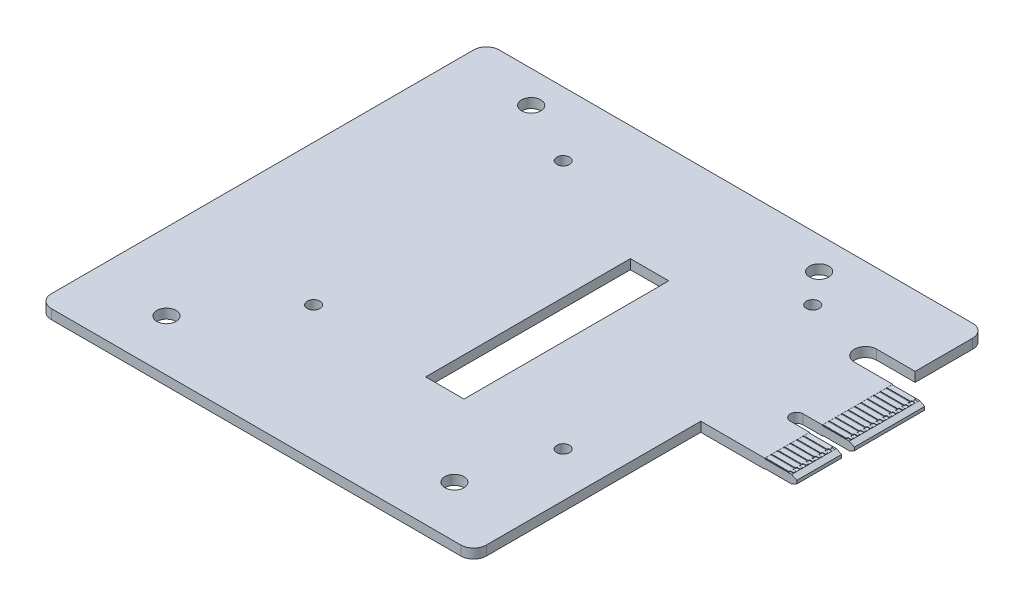
from build123d import *
from OCP.BRepFilletAPI import BRepFilletAPI_MakeChamfer

# Parameters (mm, degrees)
EXTRUDE_1_DEPTH                      = 1.5
CHAMFER_1_SIZE                       = 0.5
CHAMFER_1_SIZE2                      = 1
CHAMFER_2_SIZE                       = 1
CHAMFER_2_SIZE2                      = 0.5
CUT_EXTRUDE_1_DEPTH                  = 57.242777314
FILLET_1_R                           = 2
SKETCH_3_R                           = 1.5
CUT_EXTRUDE_2_DEPTH                  = 57.242777314
PATTERN_LINEAR_1_COUNT               = 2
PATTERN_LINEAR_1_PITCH               = 45
PATTERN_LINEAR_1_COUNT_DIR2          = 2
PATTERN_LINEAR_1_PITCH_DIR2          = 57
SKETCH_5_R                           = 1
CUT_EXTRUDE_3_DEPTH                  = 57.242777314
PATTERN_LINEAR_2_COUNT               = 2
PATTERN_LINEAR_2_PITCH               = 39
PATTERN_LINEAR_2_COUNT_DIR2          = 2
PATTERN_LINEAR_2_PITCH_DIR2          = 39
SKETCH_9_W                           = 6
SKETCH_9_H                           = 32
CUT_EXTRUDE_6_DEPTH                  = 57.242777314
SKETCH_6_W                           = 5
SKETCH_6_H                           = 20
CUT_EXTRUDE_4_DEPTH                  = 0.1
EXTRUDE_3_DEPTH                      = 0.09
CHAMFER_3_SIZE2                      = 0.09
CHAMFER_3_SIZE                       = 0.3
PATTERN_LINEAR_3_COUNT               = 11
PATTERN_LINEAR_3_PITCH               = 1
CHAMFER_3_OF_PATTERN_LINEAR_3_SIZE   = 0.3
CHAMFER_3_OF_PATTERN_LINEAR_3_SIZE_2 = 0.09
EXTRUDE_4_DEPTH                      = 0.09
CHAMFER_4_SIZE2                      = 0.09
CHAMFER_4_SIZE                       = 0.3
PATTERN_LINEAR_4_COUNT               = 7
PATTERN_LINEAR_4_PITCH               = 1
CHAMFER_4_OF_PATTERN_LINEAR_4_SIZE   = 0.3
CHAMFER_4_OF_PATTERN_LINEAR_4_SIZE_2 = 0.09
CHAMFER_5_SIZE2                      = 0.3
CHAMFER_5_SIZE                       = 0.09
PATTERN_LINEAR_5_COUNT               = 11
PATTERN_LINEAR_5_PITCH               = 1
PATTERN_LINEAR_5_COPY_1_DEPTH        = 0.09
PATTERN_LINEAR_5_COPY_2_DEPTH        = 0.09
PATTERN_LINEAR_5_COPY_3_DEPTH        = 0.09
PATTERN_LINEAR_5_COPY_4_DEPTH        = 0.09
PATTERN_LINEAR_5_COPY_5_DEPTH        = 0.09
PATTERN_LINEAR_5_COPY_6_DEPTH        = 0.09
PATTERN_LINEAR_5_COPY_7_DEPTH        = 0.09
PATTERN_LINEAR_5_COPY_8_DEPTH        = 0.09
PATTERN_LINEAR_5_COPY_9_DEPTH        = 0.09
PATTERN_LINEAR_5_COPY_10_DEPTH       = 0.09
CHAMFER_5_OF_PATTERN_LINEAR_5_SIZE   = 0.09
CHAMFER_5_OF_PATTERN_LINEAR_5_SIZE_2 = 0.3
CHAMFER_6_SIZE2                      = 0.09
CHAMFER_6_SIZE                       = 0.3
PATTERN_LINEAR_6_COUNT               = 7
PATTERN_LINEAR_6_PITCH               = 1
PATTERN_LINEAR_6_COPY_1_DEPTH        = 0.09
PATTERN_LINEAR_6_COPY_2_DEPTH        = 0.09
PATTERN_LINEAR_6_COPY_3_DEPTH        = 0.09
PATTERN_LINEAR_6_COPY_4_DEPTH        = 0.09
PATTERN_LINEAR_6_COPY_5_DEPTH        = 0.09
PATTERN_LINEAR_6_COPY_6_DEPTH        = 0.09
CHAMFER_6_OF_PATTERN_LINEAR_6_SIZE   = 0.3
CHAMFER_6_OF_PATTERN_LINEAR_6_SIZE_2 = 0.09


with BuildPart() as part:
    # 草图1 → 凸台-拉伸1 (new body)
    with BuildSketch(Plane(origin=(0, 0, 0), x_dir=(1, 0, 0), z_dir=(0, 1, 0))):
        Polygon((39, 35), (-39, 35), (-39, -35), (29, -35), (29, 0.5), (39, 0.5), (44, 0.5), (44, 20.5), (39, 20.5), align=None)
    extrude(amount=EXTRUDE_1_DEPTH)

    # 倒角1
    chamfer_1_edges = [part.edges().sort_by_distance(p)[0] for p in [
        (44, 1.5, -10.5),
    ]]
    chamfer_1_side = [part.faces().sort_by_distance(p)[0] for p in [
        (44, 0.75, -10.5),
    ]]
    chamfer(chamfer_1_edges, length=CHAMFER_1_SIZE, length2=CHAMFER_1_SIZE2, reference=chamfer_1_side[0])

    # 倒角2
    chamfer_2_edges = [part.edges().sort_by_distance(p)[0] for p in [
        (44, 0, -10.5),
    ]]
    chamfer_2_side = [part.faces().sort_by_distance(p)[0] for p in [
        (-1.521613833, 0, -1.378242075),
    ]]
    chamfer(chamfer_2_edges, length=CHAMFER_2_SIZE, length2=CHAMFER_2_SIZE2, reference=chamfer_2_side[0])

    # 草图2 → 切除-拉伸1 (cut, through all)
    with BuildSketch(Plane(origin=(0, 0, 0), x_dir=(1, 0, 0), z_dir=(0, 1, 0))):
        with BuildLine():
            Line((39, 20.5), (33, 20.5))
            ThreePointArc((33, 20.5), (31.25, 22.25), (33, 24))
            Line((33, 24), (39, 24))
            Line((39, 24), (39, 20.5))
        make_face()
        with BuildLine():
            Line((44, 7.5), (36, 7.5))
            ThreePointArc((36, 7.5), (35, 8.5), (36, 9.5))
            Line((36, 9.5), (44, 9.5))
            Line((44, 9.5), (44, 7.5))
        make_face()
    extrude(amount=CUT_EXTRUDE_1_DEPTH, mode=Mode.SUBTRACT)

    # 圆角1
    fillet_1_edges = [part.edges().sort_by_distance(p)[0] for p in [
        (-39, 0.75, -35),
        (39, 0.75, -35),
        (29, 0.75, 35),
        (-39, 0.75, 35),
    ]]
    fillet(fillet_1_edges, radius=FILLET_1_R)

    # 草图3 → 切除-拉伸2 (cut, through all)
    with BuildSketch(Plane(origin=(0, 0, 0), x_dir=(1, 0, 0), z_dir=(0, 1, 0))):
        with Locations(Location((-27, 30, 0), (0, 0, 270))):
            Circle(SKETCH_3_R)
    cut_extrude_2 = extrude(amount=CUT_EXTRUDE_2_DEPTH, mode=Mode.SUBTRACT)

    # 阵列(线性)1: Cut-Extrude 2 2 × 2
    with Locations(*[(i * PATTERN_LINEAR_1_PITCH, 0, j * PATTERN_LINEAR_1_PITCH_DIR2) for i in range(PATTERN_LINEAR_1_COUNT) for j in range(PATTERN_LINEAR_1_COUNT_DIR2) if (i, j) != (0, 0)]):
        add(cut_extrude_2, mode=Mode.SUBTRACT)

    # 草图5 → 切除-拉伸3 (cut, through all)
    with BuildSketch(Plane(origin=(0, 0, 0), x_dir=(1, 0, 0), z_dir=(0, 1, 0))):
        with Locations(Location((-17, 25, 0), (0, 0, 270))):
            Circle(SKETCH_5_R)
    cut_extrude_3 = extrude(amount=CUT_EXTRUDE_3_DEPTH, mode=Mode.SUBTRACT)

    # 阵列(线性)2: Cut-Extrude 3 2 × 2
    with Locations(*[(i * PATTERN_LINEAR_2_PITCH, 0, j * PATTERN_LINEAR_2_PITCH_DIR2) for i in range(PATTERN_LINEAR_2_COUNT) for j in range(PATTERN_LINEAR_2_COUNT_DIR2) if (i, j) != (0, 0)]):
        add(cut_extrude_3, mode=Mode.SUBTRACT)

    # 草图9 → 切除-拉伸6 (cut, through all)
    with BuildSketch(Plane(origin=(0, 0, 0), x_dir=(1, 0, 0), z_dir=(0, 1, 0))):
        with Locations((4.5, 1)):
            Rectangle(SKETCH_9_W, SKETCH_9_H)
    extrude(amount=CUT_EXTRUDE_6_DEPTH, mode=Mode.SUBTRACT)

    # 草图6 → 切除-拉伸4 (cut)
    with BuildSketch(Plane(origin=(0, 1.5, 0), x_dir=(1, 0, 0), z_dir=(0, 1, 0))):
        with Locations((41.5, 10.5)):
            Rectangle(SKETCH_6_W, SKETCH_6_H)
    cut_extrude_4 = extrude(amount=-CUT_EXTRUDE_4_DEPTH, mode=Mode.SUBTRACT)

    # 草图7 → 凸台-拉伸3 (add)
    with BuildSketch(Plane(origin=(0, 1.4, 0), x_dir=(1, 0, 0), z_dir=(0, 1, 0))):
        Polygon((39, 20.4), (42.7, 20.4), (42.7, 20.2), (43.2, 20.2), (43.2, 19.8), (42.7, 19.8), (42.7, 19.6), (39, 19.6), align=None)
    extrude_3 = extrude(amount=EXTRUDE_3_DEPTH)

    # 倒角3
    chamfer_3_edges = [part.edges().sort_by_distance(p)[0] for p in [
        (43.2, 1.49, -20),
    ]]
    chamfer_3_side = [part.faces().sort_by_distance(p)[0] for p in [
        (43.1982, 1.49, -20),
    ]]
    chamfer(chamfer_3_edges, length=CHAMFER_3_SIZE - 0.0001, length2=CHAMFER_3_SIZE2 - 0.0001, reference=chamfer_3_side[0])  # a hair under: the kernel refuses the full size

    # 阵列(线性)3: 凸台-拉伸3 ×11
    with Locations(*[(0, 0, i * PATTERN_LINEAR_3_PITCH) for i in range(1, PATTERN_LINEAR_3_COUNT)]):
        add(extrude_3)

    # 倒角3 of 阵列(线性)3
    chamfer_3_of_pattern_linear_3_edges_1 = [part.edges().sort_by_distance(p)[0] for p in [
        (43.2, 1.49, -19),
    ]]
    chamfer_3_of_pattern_linear_3_side_1 = [part.faces().sort_by_distance(p)[0] for p in [
        (43.1982, 1.49, -19),
    ]]
    chamfer_3_of_pattern_linear_3_edges_2 = [part.edges().sort_by_distance(p)[0] for p in [
        (43.2, 1.49, -18),
    ]]
    chamfer_3_of_pattern_linear_3_side_2 = [part.faces().sort_by_distance(p)[0] for p in [
        (43.1982, 1.49, -18),
    ]]
    chamfer_3_of_pattern_linear_3_edges_3 = [part.edges().sort_by_distance(p)[0] for p in [
        (43.2, 1.49, -17),
    ]]
    chamfer_3_of_pattern_linear_3_side_3 = [part.faces().sort_by_distance(p)[0] for p in [
        (43.1982, 1.49, -17),
    ]]
    chamfer_3_of_pattern_linear_3_edges_4 = [part.edges().sort_by_distance(p)[0] for p in [
        (43.2, 1.49, -16),
    ]]
    chamfer_3_of_pattern_linear_3_side_4 = [part.faces().sort_by_distance(p)[0] for p in [
        (43.1982, 1.49, -16),
    ]]
    chamfer_3_of_pattern_linear_3_edges_5 = [part.edges().sort_by_distance(p)[0] for p in [
        (43.2, 1.49, -15),
    ]]
    chamfer_3_of_pattern_linear_3_side_5 = [part.faces().sort_by_distance(p)[0] for p in [
        (43.1982, 1.49, -15),
    ]]
    chamfer_3_of_pattern_linear_3_edges_6 = [part.edges().sort_by_distance(p)[0] for p in [
        (43.2, 1.49, -14),
    ]]
    chamfer_3_of_pattern_linear_3_side_6 = [part.faces().sort_by_distance(p)[0] for p in [
        (43.1982, 1.49, -14),
    ]]
    chamfer_3_of_pattern_linear_3_edges_7 = [part.edges().sort_by_distance(p)[0] for p in [
        (43.2, 1.49, -13),
    ]]
    chamfer_3_of_pattern_linear_3_side_7 = [part.faces().sort_by_distance(p)[0] for p in [
        (43.1982, 1.49, -13),
    ]]
    chamfer_3_of_pattern_linear_3_edges_8 = [part.edges().sort_by_distance(p)[0] for p in [
        (43.2, 1.49, -12),
    ]]
    chamfer_3_of_pattern_linear_3_side_8 = [part.faces().sort_by_distance(p)[0] for p in [
        (43.1982, 1.49, -12),
    ]]
    chamfer_3_of_pattern_linear_3_edges_9 = [part.edges().sort_by_distance(p)[0] for p in [
        (43.2, 1.49, -11),
    ]]
    chamfer_3_of_pattern_linear_3_side_9 = [part.faces().sort_by_distance(p)[0] for p in [
        (43.1982, 1.49, -11),
    ]]
    chamfer_3_of_pattern_linear_3_edges_10 = [part.edges().sort_by_distance(p)[0] for p in [
        (43.2, 1.49, -10),
    ]]
    chamfer_3_of_pattern_linear_3_side_10 = [part.faces().sort_by_distance(p)[0] for p in [
        (43.1982, 1.49, -10),
    ]]
    chamfer_3_of_pattern_linear_3 = BRepFilletAPI_MakeChamfer(part.part.solid().wrapped)
    for e in chamfer_3_of_pattern_linear_3_edges_1:
        chamfer_3_of_pattern_linear_3.Add(CHAMFER_3_OF_PATTERN_LINEAR_3_SIZE - 0.0001, CHAMFER_3_OF_PATTERN_LINEAR_3_SIZE_2 - 0.0001, e.wrapped, chamfer_3_of_pattern_linear_3_side_1[0].wrapped)
    for e in chamfer_3_of_pattern_linear_3_edges_2:
        chamfer_3_of_pattern_linear_3.Add(CHAMFER_3_OF_PATTERN_LINEAR_3_SIZE - 0.0001, CHAMFER_3_OF_PATTERN_LINEAR_3_SIZE_2 - 0.0001, e.wrapped, chamfer_3_of_pattern_linear_3_side_2[0].wrapped)
    for e in chamfer_3_of_pattern_linear_3_edges_3:
        chamfer_3_of_pattern_linear_3.Add(CHAMFER_3_OF_PATTERN_LINEAR_3_SIZE - 0.0001, CHAMFER_3_OF_PATTERN_LINEAR_3_SIZE_2 - 0.0001, e.wrapped, chamfer_3_of_pattern_linear_3_side_3[0].wrapped)
    for e in chamfer_3_of_pattern_linear_3_edges_4:
        chamfer_3_of_pattern_linear_3.Add(CHAMFER_3_OF_PATTERN_LINEAR_3_SIZE - 0.0001, CHAMFER_3_OF_PATTERN_LINEAR_3_SIZE_2 - 0.0001, e.wrapped, chamfer_3_of_pattern_linear_3_side_4[0].wrapped)
    for e in chamfer_3_of_pattern_linear_3_edges_5:
        chamfer_3_of_pattern_linear_3.Add(CHAMFER_3_OF_PATTERN_LINEAR_3_SIZE - 0.0001, CHAMFER_3_OF_PATTERN_LINEAR_3_SIZE_2 - 0.0001, e.wrapped, chamfer_3_of_pattern_linear_3_side_5[0].wrapped)
    for e in chamfer_3_of_pattern_linear_3_edges_6:
        chamfer_3_of_pattern_linear_3.Add(CHAMFER_3_OF_PATTERN_LINEAR_3_SIZE - 0.0001, CHAMFER_3_OF_PATTERN_LINEAR_3_SIZE_2 - 0.0001, e.wrapped, chamfer_3_of_pattern_linear_3_side_6[0].wrapped)
    for e in chamfer_3_of_pattern_linear_3_edges_7:
        chamfer_3_of_pattern_linear_3.Add(CHAMFER_3_OF_PATTERN_LINEAR_3_SIZE - 0.0001, CHAMFER_3_OF_PATTERN_LINEAR_3_SIZE_2 - 0.0001, e.wrapped, chamfer_3_of_pattern_linear_3_side_7[0].wrapped)
    for e in chamfer_3_of_pattern_linear_3_edges_8:
        chamfer_3_of_pattern_linear_3.Add(CHAMFER_3_OF_PATTERN_LINEAR_3_SIZE - 0.0001, CHAMFER_3_OF_PATTERN_LINEAR_3_SIZE_2 - 0.0001, e.wrapped, chamfer_3_of_pattern_linear_3_side_8[0].wrapped)
    for e in chamfer_3_of_pattern_linear_3_edges_9:
        chamfer_3_of_pattern_linear_3.Add(CHAMFER_3_OF_PATTERN_LINEAR_3_SIZE - 0.0001, CHAMFER_3_OF_PATTERN_LINEAR_3_SIZE_2 - 0.0001, e.wrapped, chamfer_3_of_pattern_linear_3_side_9[0].wrapped)
    for e in chamfer_3_of_pattern_linear_3_edges_10:
        chamfer_3_of_pattern_linear_3.Add(CHAMFER_3_OF_PATTERN_LINEAR_3_SIZE - 0.0001, CHAMFER_3_OF_PATTERN_LINEAR_3_SIZE_2 - 0.0001, e.wrapped, chamfer_3_of_pattern_linear_3_side_10[0].wrapped)
    add(Compound.cast(chamfer_3_of_pattern_linear_3.Shape()), mode=Mode.REPLACE)  # a hair under: the kernel refuses the full size

    # 草图8 → 凸台-拉伸4 (add)
    with BuildSketch(Plane(origin=(0, 1.4, 0), x_dir=(1, 0, 0), z_dir=(0, 1, 0))):
        Polygon((39, 7.4), (42.7, 7.4), (42.7, 7.2), (43.2, 7.2), (43.2, 6.8), (42.7, 6.8), (42.7, 6.6), (39, 6.6), align=None)
    extrude_4 = extrude(amount=EXTRUDE_4_DEPTH)

    # 倒角4
    chamfer_4_edges = [part.edges().sort_by_distance(p)[0] for p in [
        (43.2, 1.49, -7),
    ]]
    chamfer_4_side = [part.faces().sort_by_distance(p)[0] for p in [
        (43.1982, 1.49, -7),
    ]]
    chamfer(chamfer_4_edges, length=CHAMFER_4_SIZE - 0.0001, length2=CHAMFER_4_SIZE2 - 0.0001, reference=chamfer_4_side[0])  # a hair under: the kernel refuses the full size

    # 阵列(线性)4: 凸台-拉伸4 ×7
    with Locations(*[(0, 0, i * PATTERN_LINEAR_4_PITCH) for i in range(1, PATTERN_LINEAR_4_COUNT)]):
        add(extrude_4)

    # 倒角4 of 阵列(线性)4
    chamfer_4_of_pattern_linear_4_edges_1 = [part.edges().sort_by_distance(p)[0] for p in [
        (43.2, 1.49, -6),
    ]]
    chamfer_4_of_pattern_linear_4_side_1 = [part.faces().sort_by_distance(p)[0] for p in [
        (43.1982, 1.49, -6),
    ]]
    chamfer_4_of_pattern_linear_4_edges_2 = [part.edges().sort_by_distance(p)[0] for p in [
        (43.2, 1.49, -5),
    ]]
    chamfer_4_of_pattern_linear_4_side_2 = [part.faces().sort_by_distance(p)[0] for p in [
        (43.1982, 1.49, -5),
    ]]
    chamfer_4_of_pattern_linear_4_edges_3 = [part.edges().sort_by_distance(p)[0] for p in [
        (43.2, 1.49, -4),
    ]]
    chamfer_4_of_pattern_linear_4_side_3 = [part.faces().sort_by_distance(p)[0] for p in [
        (43.1982, 1.49, -4),
    ]]
    chamfer_4_of_pattern_linear_4_edges_4 = [part.edges().sort_by_distance(p)[0] for p in [
        (43.2, 1.49, -3),
    ]]
    chamfer_4_of_pattern_linear_4_side_4 = [part.faces().sort_by_distance(p)[0] for p in [
        (43.1982, 1.49, -3),
    ]]
    chamfer_4_of_pattern_linear_4_edges_5 = [part.edges().sort_by_distance(p)[0] for p in [
        (43.2, 1.49, -2),
    ]]
    chamfer_4_of_pattern_linear_4_side_5 = [part.faces().sort_by_distance(p)[0] for p in [
        (43.1982, 1.49, -2),
    ]]
    chamfer_4_of_pattern_linear_4_edges_6 = [part.edges().sort_by_distance(p)[0] for p in [
        (43.2, 1.49, -1),
    ]]
    chamfer_4_of_pattern_linear_4_side_6 = [part.faces().sort_by_distance(p)[0] for p in [
        (43.1982, 1.49, -1),
    ]]
    chamfer_4_of_pattern_linear_4 = BRepFilletAPI_MakeChamfer(part.part.solid().wrapped)
    for e in chamfer_4_of_pattern_linear_4_edges_1:
        chamfer_4_of_pattern_linear_4.Add(CHAMFER_4_OF_PATTERN_LINEAR_4_SIZE - 0.0001, CHAMFER_4_OF_PATTERN_LINEAR_4_SIZE_2 - 0.0001, e.wrapped, chamfer_4_of_pattern_linear_4_side_1[0].wrapped)
    for e in chamfer_4_of_pattern_linear_4_edges_2:
        chamfer_4_of_pattern_linear_4.Add(CHAMFER_4_OF_PATTERN_LINEAR_4_SIZE - 0.0001, CHAMFER_4_OF_PATTERN_LINEAR_4_SIZE_2 - 0.0001, e.wrapped, chamfer_4_of_pattern_linear_4_side_2[0].wrapped)
    for e in chamfer_4_of_pattern_linear_4_edges_3:
        chamfer_4_of_pattern_linear_4.Add(CHAMFER_4_OF_PATTERN_LINEAR_4_SIZE - 0.0001, CHAMFER_4_OF_PATTERN_LINEAR_4_SIZE_2 - 0.0001, e.wrapped, chamfer_4_of_pattern_linear_4_side_3[0].wrapped)
    for e in chamfer_4_of_pattern_linear_4_edges_4:
        chamfer_4_of_pattern_linear_4.Add(CHAMFER_4_OF_PATTERN_LINEAR_4_SIZE - 0.0001, CHAMFER_4_OF_PATTERN_LINEAR_4_SIZE_2 - 0.0001, e.wrapped, chamfer_4_of_pattern_linear_4_side_4[0].wrapped)
    for e in chamfer_4_of_pattern_linear_4_edges_5:
        chamfer_4_of_pattern_linear_4.Add(CHAMFER_4_OF_PATTERN_LINEAR_4_SIZE - 0.0001, CHAMFER_4_OF_PATTERN_LINEAR_4_SIZE_2 - 0.0001, e.wrapped, chamfer_4_of_pattern_linear_4_side_5[0].wrapped)
    for e in chamfer_4_of_pattern_linear_4_edges_6:
        chamfer_4_of_pattern_linear_4.Add(CHAMFER_4_OF_PATTERN_LINEAR_4_SIZE - 0.0001, CHAMFER_4_OF_PATTERN_LINEAR_4_SIZE_2 - 0.0001, e.wrapped, chamfer_4_of_pattern_linear_4_side_6[0].wrapped)
    add(Compound.cast(chamfer_4_of_pattern_linear_4.Shape()), mode=Mode.REPLACE)  # a hair under: the kernel refuses the full size

    # 镜向2: 切除-拉伸4 across plane
    add(cut_extrude_4.mirror(Plane.ZX.offset(0.75)), mode=Mode.SUBTRACT)

    # 镜向5: 凸台-拉伸3 across plane
    add(extrude_3.mirror(Plane.ZX.offset(0.75)))

    # 倒角5
    chamfer_5_edges = [part.edges().sort_by_distance(p)[0] for p in [
        (43.2, 0.01, -20),
    ]]
    chamfer_5_side = [part.faces().sort_by_distance(p)[0] for p in [
        (43.2, 0.0118, -20),
    ]]
    chamfer(chamfer_5_edges, length=CHAMFER_5_SIZE - 0.0001, length2=CHAMFER_5_SIZE2 - 0.0001, reference=chamfer_5_side[0])  # a hair under: the kernel refuses the full size

    # 阵列(线性)5: 凸台-拉伸3 ×11
    with Locations(*[(0, 0, i * PATTERN_LINEAR_5_PITCH) for i in range(1, PATTERN_LINEAR_5_COUNT)]):
        add(extrude_3)

    # 阵列(线性)5 copy 1 sketch → 阵列(线性)5 copy 1 (add)
    with BuildSketch(Plane(origin=(0, 0.1, 1), x_dir=(1, 0, 0), z_dir=(0, -1, 0))):
        Polygon((39, -20.4), (42.7, -20.4), (42.7, -20.2), (43.2, -20.2), (43.2, -19.8), (42.7, -19.8), (42.7, -19.6), (39, -19.6), align=None)
    extrude(amount=PATTERN_LINEAR_5_COPY_1_DEPTH)

    # 阵列(线性)5 copy 2 sketch → 阵列(线性)5 copy 2 (add)
    with BuildSketch(Plane(origin=(0, 0.1, 2), x_dir=(1, 0, 0), z_dir=(0, -1, 0))):
        Polygon((39, -20.4), (42.7, -20.4), (42.7, -20.2), (43.2, -20.2), (43.2, -19.8), (42.7, -19.8), (42.7, -19.6), (39, -19.6), align=None)
    extrude(amount=PATTERN_LINEAR_5_COPY_2_DEPTH)

    # 阵列(线性)5 copy 3 sketch → 阵列(线性)5 copy 3 (add)
    with BuildSketch(Plane(origin=(0, 0.1, 3), x_dir=(1, 0, 0), z_dir=(0, -1, 0))):
        Polygon((39, -20.4), (42.7, -20.4), (42.7, -20.2), (43.2, -20.2), (43.2, -19.8), (42.7, -19.8), (42.7, -19.6), (39, -19.6), align=None)
    extrude(amount=PATTERN_LINEAR_5_COPY_3_DEPTH)

    # 阵列(线性)5 copy 4 sketch → 阵列(线性)5 copy 4 (add)
    with BuildSketch(Plane(origin=(0, 0.1, 4), x_dir=(1, 0, 0), z_dir=(0, -1, 0))):
        Polygon((39, -20.4), (42.7, -20.4), (42.7, -20.2), (43.2, -20.2), (43.2, -19.8), (42.7, -19.8), (42.7, -19.6), (39, -19.6), align=None)
    extrude(amount=PATTERN_LINEAR_5_COPY_4_DEPTH)

    # 阵列(线性)5 copy 5 sketch → 阵列(线性)5 copy 5 (add)
    with BuildSketch(Plane(origin=(0, 0.1, 5), x_dir=(1, 0, 0), z_dir=(0, -1, 0))):
        Polygon((39, -20.4), (42.7, -20.4), (42.7, -20.2), (43.2, -20.2), (43.2, -19.8), (42.7, -19.8), (42.7, -19.6), (39, -19.6), align=None)
    extrude(amount=PATTERN_LINEAR_5_COPY_5_DEPTH)

    # 阵列(线性)5 copy 6 sketch → 阵列(线性)5 copy 6 (add)
    with BuildSketch(Plane(origin=(0, 0.1, 6), x_dir=(1, 0, 0), z_dir=(0, -1, 0))):
        Polygon((39, -20.4), (42.7, -20.4), (42.7, -20.2), (43.2, -20.2), (43.2, -19.8), (42.7, -19.8), (42.7, -19.6), (39, -19.6), align=None)
    extrude(amount=PATTERN_LINEAR_5_COPY_6_DEPTH)

    # 阵列(线性)5 copy 7 sketch → 阵列(线性)5 copy 7 (add)
    with BuildSketch(Plane(origin=(0, 0.1, 7), x_dir=(1, 0, 0), z_dir=(0, -1, 0))):
        Polygon((39, -20.4), (42.7, -20.4), (42.7, -20.2), (43.2, -20.2), (43.2, -19.8), (42.7, -19.8), (42.7, -19.6), (39, -19.6), align=None)
    extrude(amount=PATTERN_LINEAR_5_COPY_7_DEPTH)

    # 阵列(线性)5 copy 8 sketch → 阵列(线性)5 copy 8 (add)
    with BuildSketch(Plane(origin=(0, 0.1, 8), x_dir=(1, 0, 0), z_dir=(0, -1, 0))):
        Polygon((39, -20.4), (42.7, -20.4), (42.7, -20.2), (43.2, -20.2), (43.2, -19.8), (42.7, -19.8), (42.7, -19.6), (39, -19.6), align=None)
    extrude(amount=PATTERN_LINEAR_5_COPY_8_DEPTH)

    # 阵列(线性)5 copy 9 sketch → 阵列(线性)5 copy 9 (add)
    with BuildSketch(Plane(origin=(0, 0.1, 9), x_dir=(1, 0, 0), z_dir=(0, -1, 0))):
        Polygon((39, -20.4), (42.7, -20.4), (42.7, -20.2), (43.2, -20.2), (43.2, -19.8), (42.7, -19.8), (42.7, -19.6), (39, -19.6), align=None)
    extrude(amount=PATTERN_LINEAR_5_COPY_9_DEPTH)

    # 阵列(线性)5 copy 10 sketch → 阵列(线性)5 copy 10 (add)
    with BuildSketch(Plane(origin=(0, 0.1, 10), x_dir=(1, 0, 0), z_dir=(0, -1, 0))):
        Polygon((39, -20.4), (42.7, -20.4), (42.7, -20.2), (43.2, -20.2), (43.2, -19.8), (42.7, -19.8), (42.7, -19.6), (39, -19.6), align=None)
    extrude(amount=PATTERN_LINEAR_5_COPY_10_DEPTH)

    # 倒角5 of 阵列(线性)5
    chamfer_5_of_pattern_linear_5_edges_1 = [part.edges().sort_by_distance(p)[0] for p in [
        (43.2, 0.01, -19),
    ]]
    chamfer_5_of_pattern_linear_5_side_1 = [part.faces().sort_by_distance(p)[0] for p in [
        (43.2, 0.0118, -19),
    ]]
    chamfer_5_of_pattern_linear_5_edges_2 = [part.edges().sort_by_distance(p)[0] for p in [
        (43.2, 0.01, -18),
    ]]
    chamfer_5_of_pattern_linear_5_side_2 = [part.faces().sort_by_distance(p)[0] for p in [
        (43.2, 0.0118, -18),
    ]]
    chamfer_5_of_pattern_linear_5_edges_3 = [part.edges().sort_by_distance(p)[0] for p in [
        (43.2, 0.01, -17),
    ]]
    chamfer_5_of_pattern_linear_5_side_3 = [part.faces().sort_by_distance(p)[0] for p in [
        (43.2, 0.0118, -17),
    ]]
    chamfer_5_of_pattern_linear_5_edges_4 = [part.edges().sort_by_distance(p)[0] for p in [
        (43.2, 0.01, -16),
    ]]
    chamfer_5_of_pattern_linear_5_side_4 = [part.faces().sort_by_distance(p)[0] for p in [
        (43.2, 0.0118, -16),
    ]]
    chamfer_5_of_pattern_linear_5_edges_5 = [part.edges().sort_by_distance(p)[0] for p in [
        (43.2, 0.01, -15),
    ]]
    chamfer_5_of_pattern_linear_5_side_5 = [part.faces().sort_by_distance(p)[0] for p in [
        (43.2, 0.0118, -15),
    ]]
    chamfer_5_of_pattern_linear_5_edges_6 = [part.edges().sort_by_distance(p)[0] for p in [
        (43.2, 0.01, -14),
    ]]
    chamfer_5_of_pattern_linear_5_side_6 = [part.faces().sort_by_distance(p)[0] for p in [
        (43.2, 0.0118, -14),
    ]]
    chamfer_5_of_pattern_linear_5_edges_7 = [part.edges().sort_by_distance(p)[0] for p in [
        (43.2, 0.01, -13),
    ]]
    chamfer_5_of_pattern_linear_5_side_7 = [part.faces().sort_by_distance(p)[0] for p in [
        (43.2, 0.0118, -13),
    ]]
    chamfer_5_of_pattern_linear_5_edges_8 = [part.edges().sort_by_distance(p)[0] for p in [
        (43.2, 0.01, -12),
    ]]
    chamfer_5_of_pattern_linear_5_side_8 = [part.faces().sort_by_distance(p)[0] for p in [
        (43.2, 0.0118, -12),
    ]]
    chamfer_5_of_pattern_linear_5_edges_9 = [part.edges().sort_by_distance(p)[0] for p in [
        (43.2, 0.01, -11),
    ]]
    chamfer_5_of_pattern_linear_5_side_9 = [part.faces().sort_by_distance(p)[0] for p in [
        (43.2, 0.0118, -11),
    ]]
    chamfer_5_of_pattern_linear_5_edges_10 = [part.edges().sort_by_distance(p)[0] for p in [
        (43.2, 0.01, -10),
    ]]
    chamfer_5_of_pattern_linear_5_side_10 = [part.faces().sort_by_distance(p)[0] for p in [
        (43.2, 0.0118, -10),
    ]]
    chamfer_5_of_pattern_linear_5 = BRepFilletAPI_MakeChamfer(part.part.solid().wrapped)
    for e in chamfer_5_of_pattern_linear_5_edges_1:
        chamfer_5_of_pattern_linear_5.Add(CHAMFER_5_OF_PATTERN_LINEAR_5_SIZE - 0.0001, CHAMFER_5_OF_PATTERN_LINEAR_5_SIZE_2 - 0.0001, e.wrapped, chamfer_5_of_pattern_linear_5_side_1[0].wrapped)
    for e in chamfer_5_of_pattern_linear_5_edges_2:
        chamfer_5_of_pattern_linear_5.Add(CHAMFER_5_OF_PATTERN_LINEAR_5_SIZE - 0.0001, CHAMFER_5_OF_PATTERN_LINEAR_5_SIZE_2 - 0.0001, e.wrapped, chamfer_5_of_pattern_linear_5_side_2[0].wrapped)
    for e in chamfer_5_of_pattern_linear_5_edges_3:
        chamfer_5_of_pattern_linear_5.Add(CHAMFER_5_OF_PATTERN_LINEAR_5_SIZE - 0.0001, CHAMFER_5_OF_PATTERN_LINEAR_5_SIZE_2 - 0.0001, e.wrapped, chamfer_5_of_pattern_linear_5_side_3[0].wrapped)
    for e in chamfer_5_of_pattern_linear_5_edges_4:
        chamfer_5_of_pattern_linear_5.Add(CHAMFER_5_OF_PATTERN_LINEAR_5_SIZE - 0.0001, CHAMFER_5_OF_PATTERN_LINEAR_5_SIZE_2 - 0.0001, e.wrapped, chamfer_5_of_pattern_linear_5_side_4[0].wrapped)
    for e in chamfer_5_of_pattern_linear_5_edges_5:
        chamfer_5_of_pattern_linear_5.Add(CHAMFER_5_OF_PATTERN_LINEAR_5_SIZE - 0.0001, CHAMFER_5_OF_PATTERN_LINEAR_5_SIZE_2 - 0.0001, e.wrapped, chamfer_5_of_pattern_linear_5_side_5[0].wrapped)
    for e in chamfer_5_of_pattern_linear_5_edges_6:
        chamfer_5_of_pattern_linear_5.Add(CHAMFER_5_OF_PATTERN_LINEAR_5_SIZE - 0.0001, CHAMFER_5_OF_PATTERN_LINEAR_5_SIZE_2 - 0.0001, e.wrapped, chamfer_5_of_pattern_linear_5_side_6[0].wrapped)
    for e in chamfer_5_of_pattern_linear_5_edges_7:
        chamfer_5_of_pattern_linear_5.Add(CHAMFER_5_OF_PATTERN_LINEAR_5_SIZE - 0.0001, CHAMFER_5_OF_PATTERN_LINEAR_5_SIZE_2 - 0.0001, e.wrapped, chamfer_5_of_pattern_linear_5_side_7[0].wrapped)
    for e in chamfer_5_of_pattern_linear_5_edges_8:
        chamfer_5_of_pattern_linear_5.Add(CHAMFER_5_OF_PATTERN_LINEAR_5_SIZE - 0.0001, CHAMFER_5_OF_PATTERN_LINEAR_5_SIZE_2 - 0.0001, e.wrapped, chamfer_5_of_pattern_linear_5_side_8[0].wrapped)
    for e in chamfer_5_of_pattern_linear_5_edges_9:
        chamfer_5_of_pattern_linear_5.Add(CHAMFER_5_OF_PATTERN_LINEAR_5_SIZE - 0.0001, CHAMFER_5_OF_PATTERN_LINEAR_5_SIZE_2 - 0.0001, e.wrapped, chamfer_5_of_pattern_linear_5_side_9[0].wrapped)
    for e in chamfer_5_of_pattern_linear_5_edges_10:
        chamfer_5_of_pattern_linear_5.Add(CHAMFER_5_OF_PATTERN_LINEAR_5_SIZE - 0.0001, CHAMFER_5_OF_PATTERN_LINEAR_5_SIZE_2 - 0.0001, e.wrapped, chamfer_5_of_pattern_linear_5_side_10[0].wrapped)
    add(Compound.cast(chamfer_5_of_pattern_linear_5.Shape()), mode=Mode.REPLACE)  # a hair under: the kernel refuses the full size

    # 镜向7: 凸台-拉伸4 across plane
    add(extrude_4.mirror(Plane.ZX.offset(0.75)))

    # 倒角6
    chamfer_6_edges = [part.edges().sort_by_distance(p)[0] for p in [
        (43.2, 0.01, -7),
    ]]
    chamfer_6_side = [part.faces().sort_by_distance(p)[0] for p in [
        (43.1982, 0.01, -7),
    ]]
    chamfer(chamfer_6_edges, length=CHAMFER_6_SIZE - 0.0001, length2=CHAMFER_6_SIZE2 - 0.0001, reference=chamfer_6_side[0])  # a hair under: the kernel refuses the full size

    # 阵列(线性)6: 凸台-拉伸4 ×7
    with Locations(*[(0, 0, i * PATTERN_LINEAR_6_PITCH) for i in range(1, PATTERN_LINEAR_6_COUNT)]):
        add(extrude_4)

    # 阵列(线性)6 copy 1 sketch → 阵列(线性)6 copy 1 (add)
    with BuildSketch(Plane(origin=(0, 0.1, 1), x_dir=(1, 0, 0), z_dir=(0, -1, 0))):
        Polygon((39, -7.4), (42.7, -7.4), (42.7, -7.2), (43.2, -7.2), (43.2, -6.8), (42.7, -6.8), (42.7, -6.6), (39, -6.6), align=None)
    extrude(amount=PATTERN_LINEAR_6_COPY_1_DEPTH)

    # 阵列(线性)6 copy 2 sketch → 阵列(线性)6 copy 2 (add)
    with BuildSketch(Plane(origin=(0, 0.1, 2), x_dir=(1, 0, 0), z_dir=(0, -1, 0))):
        Polygon((39, -7.4), (42.7, -7.4), (42.7, -7.2), (43.2, -7.2), (43.2, -6.8), (42.7, -6.8), (42.7, -6.6), (39, -6.6), align=None)
    extrude(amount=PATTERN_LINEAR_6_COPY_2_DEPTH)

    # 阵列(线性)6 copy 3 sketch → 阵列(线性)6 copy 3 (add)
    with BuildSketch(Plane(origin=(0, 0.1, 3), x_dir=(1, 0, 0), z_dir=(0, -1, 0))):
        Polygon((39, -7.4), (42.7, -7.4), (42.7, -7.2), (43.2, -7.2), (43.2, -6.8), (42.7, -6.8), (42.7, -6.6), (39, -6.6), align=None)
    extrude(amount=PATTERN_LINEAR_6_COPY_3_DEPTH)

    # 阵列(线性)6 copy 4 sketch → 阵列(线性)6 copy 4 (add)
    with BuildSketch(Plane(origin=(0, 0.1, 4), x_dir=(1, 0, 0), z_dir=(0, -1, 0))):
        Polygon((39, -7.4), (42.7, -7.4), (42.7, -7.2), (43.2, -7.2), (43.2, -6.8), (42.7, -6.8), (42.7, -6.6), (39, -6.6), align=None)
    extrude(amount=PATTERN_LINEAR_6_COPY_4_DEPTH)

    # 阵列(线性)6 copy 5 sketch → 阵列(线性)6 copy 5 (add)
    with BuildSketch(Plane(origin=(0, 0.1, 5), x_dir=(1, 0, 0), z_dir=(0, -1, 0))):
        Polygon((39, -7.4), (42.7, -7.4), (42.7, -7.2), (43.2, -7.2), (43.2, -6.8), (42.7, -6.8), (42.7, -6.6), (39, -6.6), align=None)
    extrude(amount=PATTERN_LINEAR_6_COPY_5_DEPTH)

    # 阵列(线性)6 copy 6 sketch → 阵列(线性)6 copy 6 (add)
    with BuildSketch(Plane(origin=(0, 0.1, 6), x_dir=(1, 0, 0), z_dir=(0, -1, 0))):
        Polygon((39, -7.4), (42.7, -7.4), (42.7, -7.2), (43.2, -7.2), (43.2, -6.8), (42.7, -6.8), (42.7, -6.6), (39, -6.6), align=None)
    extrude(amount=PATTERN_LINEAR_6_COPY_6_DEPTH)

    # 倒角6 of 阵列(线性)6
    chamfer_6_of_pattern_linear_6_edges_1 = [part.edges().sort_by_distance(p)[0] for p in [
        (43.2, 0.01, -6),
    ]]
    chamfer_6_of_pattern_linear_6_side_1 = [part.faces().sort_by_distance(p)[0] for p in [
        (43.1982, 0.01, -6),
    ]]
    chamfer_6_of_pattern_linear_6_edges_2 = [part.edges().sort_by_distance(p)[0] for p in [
        (43.2, 0.01, -5),
    ]]
    chamfer_6_of_pattern_linear_6_side_2 = [part.faces().sort_by_distance(p)[0] for p in [
        (43.1982, 0.01, -5),
    ]]
    chamfer_6_of_pattern_linear_6_edges_3 = [part.edges().sort_by_distance(p)[0] for p in [
        (43.2, 0.01, -4),
    ]]
    chamfer_6_of_pattern_linear_6_side_3 = [part.faces().sort_by_distance(p)[0] for p in [
        (43.1982, 0.01, -4),
    ]]
    chamfer_6_of_pattern_linear_6_edges_4 = [part.edges().sort_by_distance(p)[0] for p in [
        (43.2, 0.01, -3),
    ]]
    chamfer_6_of_pattern_linear_6_side_4 = [part.faces().sort_by_distance(p)[0] for p in [
        (43.1982, 0.01, -3),
    ]]
    chamfer_6_of_pattern_linear_6_edges_5 = [part.edges().sort_by_distance(p)[0] for p in [
        (43.2, 0.01, -2),
    ]]
    chamfer_6_of_pattern_linear_6_side_5 = [part.faces().sort_by_distance(p)[0] for p in [
        (43.1982, 0.01, -2),
    ]]
    chamfer_6_of_pattern_linear_6_edges_6 = [part.edges().sort_by_distance(p)[0] for p in [
        (43.2, 0.01, -1),
    ]]
    chamfer_6_of_pattern_linear_6_side_6 = [part.faces().sort_by_distance(p)[0] for p in [
        (43.1982, 0.01, -1),
    ]]
    chamfer_6_of_pattern_linear_6 = BRepFilletAPI_MakeChamfer(part.part.solid().wrapped)
    for e in chamfer_6_of_pattern_linear_6_edges_1:
        chamfer_6_of_pattern_linear_6.Add(CHAMFER_6_OF_PATTERN_LINEAR_6_SIZE - 0.0001, CHAMFER_6_OF_PATTERN_LINEAR_6_SIZE_2 - 0.0001, e.wrapped, chamfer_6_of_pattern_linear_6_side_1[0].wrapped)
    for e in chamfer_6_of_pattern_linear_6_edges_2:
        chamfer_6_of_pattern_linear_6.Add(CHAMFER_6_OF_PATTERN_LINEAR_6_SIZE - 0.0001, CHAMFER_6_OF_PATTERN_LINEAR_6_SIZE_2 - 0.0001, e.wrapped, chamfer_6_of_pattern_linear_6_side_2[0].wrapped)
    for e in chamfer_6_of_pattern_linear_6_edges_3:
        chamfer_6_of_pattern_linear_6.Add(CHAMFER_6_OF_PATTERN_LINEAR_6_SIZE - 0.0001, CHAMFER_6_OF_PATTERN_LINEAR_6_SIZE_2 - 0.0001, e.wrapped, chamfer_6_of_pattern_linear_6_side_3[0].wrapped)
    for e in chamfer_6_of_pattern_linear_6_edges_4:
        chamfer_6_of_pattern_linear_6.Add(CHAMFER_6_OF_PATTERN_LINEAR_6_SIZE - 0.0001, CHAMFER_6_OF_PATTERN_LINEAR_6_SIZE_2 - 0.0001, e.wrapped, chamfer_6_of_pattern_linear_6_side_4[0].wrapped)
    for e in chamfer_6_of_pattern_linear_6_edges_5:
        chamfer_6_of_pattern_linear_6.Add(CHAMFER_6_OF_PATTERN_LINEAR_6_SIZE - 0.0001, CHAMFER_6_OF_PATTERN_LINEAR_6_SIZE_2 - 0.0001, e.wrapped, chamfer_6_of_pattern_linear_6_side_5[0].wrapped)
    for e in chamfer_6_of_pattern_linear_6_edges_6:
        chamfer_6_of_pattern_linear_6.Add(CHAMFER_6_OF_PATTERN_LINEAR_6_SIZE - 0.0001, CHAMFER_6_OF_PATTERN_LINEAR_6_SIZE_2 - 0.0001, e.wrapped, chamfer_6_of_pattern_linear_6_side_6[0].wrapped)
    add(Compound.cast(chamfer_6_of_pattern_linear_6.Shape()), mode=Mode.REPLACE)  # a hair under: the kernel refuses the full size


solid = part.part
